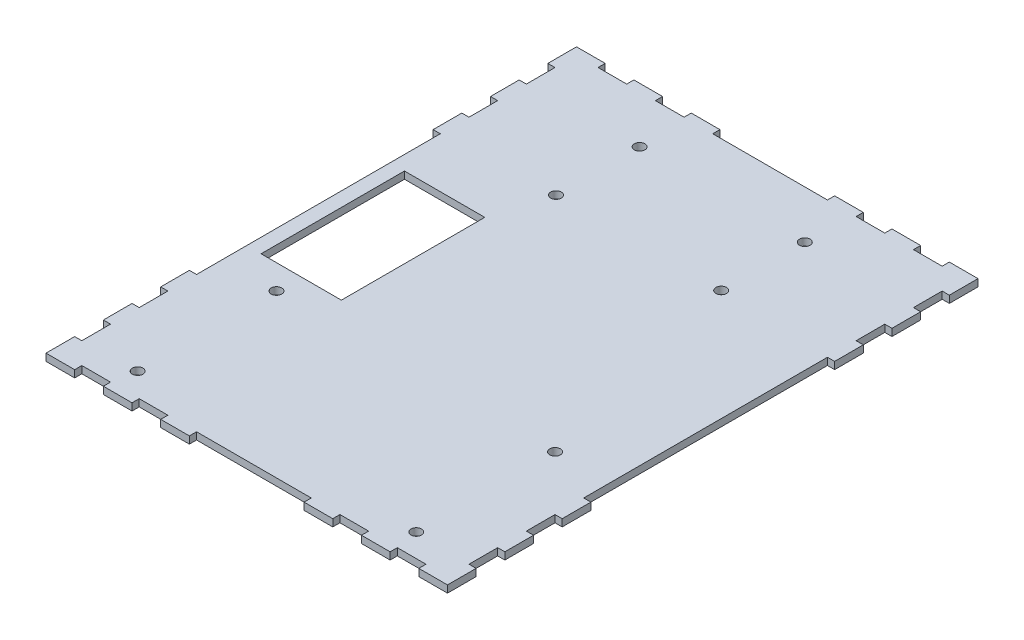
from build123d import *

# Parameters (mm, degrees)
BOSS_EXTRUDE1_DEPTH = 3.175
SKETCH5_W           = 50.8
SKETCH5_H           = 3.175
SKETCH5_W_2         = 12.7
CUT_EXTRUDE4_DEPTH  = 7.62
SKETCH7_W           = 35.56
SKETCH7_H           = 63.5
CUT_EXTRUDE5_DEPTH  = 7.62
SKETCH8_R           = 2.3495
CUT_EXTRUDE6_DEPTH  = 7.62
SKETCH9_R           = 2.3495
CUT_EXTRUDE7_DEPTH  = 25.4


with BuildPart() as part:
    # Sketch1 → Boss-Extrude1 (new body)
    with BuildSketch(Plane(origin=(0, 0, 0), x_dir=(1, 0, 0), z_dir=(0, 1, 0))):
        Polygon((3.175, 209.55), (0, 209.55), (0, 196.85), (3.175, 196.85), (3.175, 184.15), (0, 184.15), (0, 171.45), (3.175, 171.45), (3.175, 63.5), (0, 63.5), (0, 50.8), (3.175, 50.8), (3.175, 38.1), (0, 38.1), (0, 25.4), (3.175, 25.4), (3.175, 12.7), (0, 12.7), (0, 0), (177.8, 0), (177.8, 12.7), (174.625, 12.7), (174.625, 25.4), (177.8, 25.4), (177.8, 38.1), (174.625, 38.1), (174.625, 50.8), (177.8, 50.8), (177.8, 63.5), (174.625, 63.5), (174.625, 171.45), (177.8, 171.45), (177.8, 184.15), (174.625, 184.15), (174.625, 196.85), (177.8, 196.85), (177.8, 209.55), (174.625, 209.55), (174.625, 222.25), (177.8, 222.25), (177.8, 234.95), (0, 234.95), (0, 222.25), (3.175, 222.25), align=None)
    extrude(amount=BOSS_EXTRUDE1_DEPTH)

    # Sketch5 → Cut-Extrude4 (cut)
    with BuildSketch(Plane(origin=(0, 3.175, 0), x_dir=(1, 0, 0), z_dir=(0, 1, 0))):
        with Locations((88.9, 1.5875)):
            Rectangle(SKETCH5_W, SKETCH5_H)
        with Locations((44.45, 1.5875)):
            Rectangle(SKETCH5_W_2, SKETCH5_H)
        with Locations((133.35, 1.5875)):
            Rectangle(SKETCH5_W_2, SKETCH5_H)
        with Locations((19.05, 1.5875)):
            Rectangle(SKETCH5_W_2, SKETCH5_H)
        with Locations((158.75, 1.5875)):
            Rectangle(SKETCH5_W_2, SKETCH5_H)
    cut_extrude4 = extrude(amount=-CUT_EXTRUDE4_DEPTH, mode=Mode.SUBTRACT)

    # Mirror1: Cut-Extrude4 across plane
    add(cut_extrude4.mirror(Plane.XY.offset(-117.475)), mode=Mode.SUBTRACT)

    # Sketch7 → Cut-Extrude5 (cut)
    with BuildSketch(Plane(origin=(0, 3.175, 0), x_dir=(1, 0, 0), z_dir=(0, 1, 0))):
        with Locations((27.305, 117.475)):
            Rectangle(SKETCH7_W, SKETCH7_H)
    extrude(amount=-CUT_EXTRUDE5_DEPTH, mode=Mode.SUBTRACT)

    # Sketch8 → Cut-Extrude6 (cut)
    with BuildSketch(Plane(origin=(0, 3.175, 0), x_dir=(1, 0, 0), z_dir=(0, 1, 0))):
        with Locations((27.208949392, 13.37707256)):
            Circle(SKETCH8_R)
        with Locations((150.591050608, 13.37707256)):
            Circle(SKETCH8_R)
        with Locations((27.208949392, 74.849360588)):
            Circle(SKETCH8_R)
        with Locations((150.591050608, 74.849360588)):
            Circle(SKETCH8_R)
    extrude(amount=-CUT_EXTRUDE6_DEPTH, mode=Mode.SUBTRACT)

    # Sketch9 → Cut-Extrude7 (cut)
    with BuildSketch(Plane(origin=(0, 3.175, 0), x_dir=(1, 0, 0), z_dir=(0, 1, 0))):
        with Locations((52.32122124, 210.560282968)):
            Circle(SKETCH9_R)
        with Locations((52.32122124, 173.54571463)):
            Circle(SKETCH9_R)
        with Locations((125.47877876, 173.54571463)):
            Circle(SKETCH9_R)
        with Locations((125.47877876, 210.560282968)):
            Circle(SKETCH9_R)
    extrude(amount=-CUT_EXTRUDE7_DEPTH, mode=Mode.SUBTRACT)


solid = part.part
